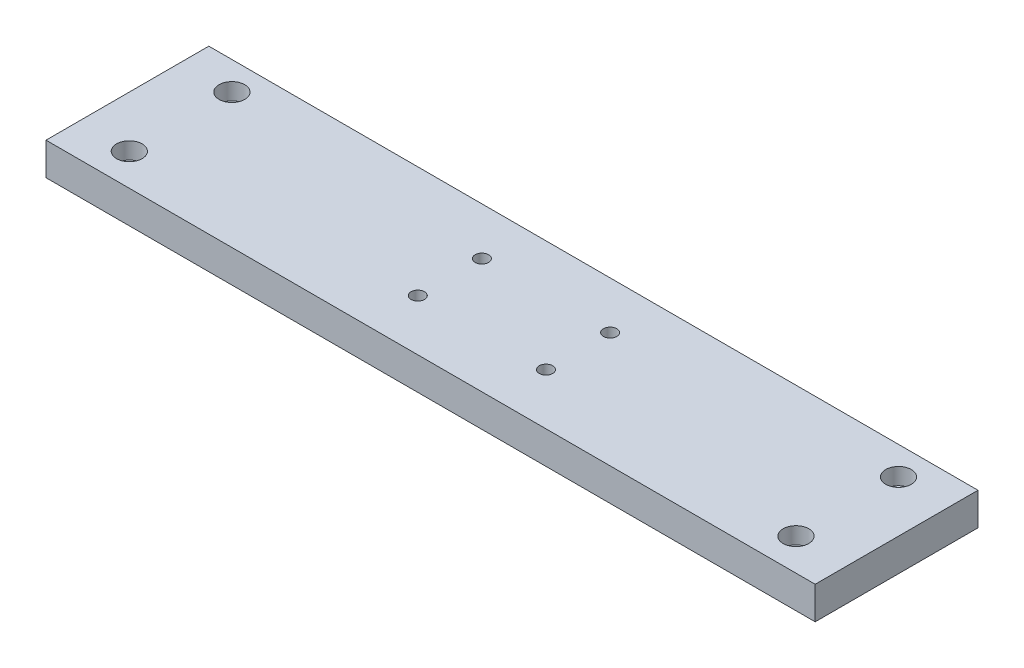
from build123d import *

# Parameters (mm, degrees)
SKETCH1_W           = 600
SKETCH1_H           = 127
BOSS_EXTRUDE1_DEPTH = 25.4
SKETCH2_R           = 6
CUT_EXTRUDE1_DEPTH  = 25.4
SKETCH3_R           = 5.25
CUT_EXTRUDE2_DEPTH  = 25.4
SKETCH4_R           = 10
CUT_EXTRUDE3_DEPTH  = 13


with BuildPart() as part:
    # Sketch1 → Boss-Extrude1 (new body)
    with BuildSketch(Plane(origin=(0, 0, 0), x_dir=(1, 0, 0), z_dir=(0, 1, 0))):
        with Locations((300, 63.5)):
            Rectangle(SKETCH1_W, SKETCH1_H)
    extrude(amount=BOSS_EXTRUDE1_DEPTH)

    # Sketch2 → Cut-Extrude1 (cut)
    with BuildSketch(Plane(origin=(0, 25.4, 0), x_dir=(1, 0, 0), z_dir=(0, 1, 0))):
        with Locations((40, 105)):
            Circle(SKETCH2_R)
        with Locations((40, 25)):
            Circle(SKETCH2_R)
        with Locations((560, 25)):
            Circle(SKETCH2_R)
        with Locations((560, 105)):
            Circle(SKETCH2_R)
    extrude(amount=-CUT_EXTRUDE1_DEPTH, mode=Mode.SUBTRACT)

    # Sketch3 → Cut-Extrude2 (cut)
    with BuildSketch(Plane(origin=(0, 25.4, 0), x_dir=(1, 0, 0), z_dir=(0, 1, 0))):
        with Locations((250, 90)):
            Circle(SKETCH3_R)
        with Locations((250, 40)):
            Circle(SKETCH3_R)
        with Locations((350, 40)):
            Circle(SKETCH3_R)
        with Locations((350, 90)):
            Circle(SKETCH3_R)
    extrude(amount=-CUT_EXTRUDE2_DEPTH, mode=Mode.SUBTRACT)

    # Sketch4 → Cut-Extrude3 (cut)
    with BuildSketch(Plane(origin=(0, 25.4, 0), x_dir=(1, 0, 0), z_dir=(0, 1, 0))):
        with Locations((40, 105)):
            Circle(SKETCH4_R)
        with Locations((40, 25)):
            Circle(SKETCH4_R)
        with Locations((560, 25)):
            Circle(SKETCH4_R)
        with Locations((560, 105)):
            Circle(SKETCH4_R)
    extrude(amount=-CUT_EXTRUDE3_DEPTH, mode=Mode.SUBTRACT)


solid = part.part
